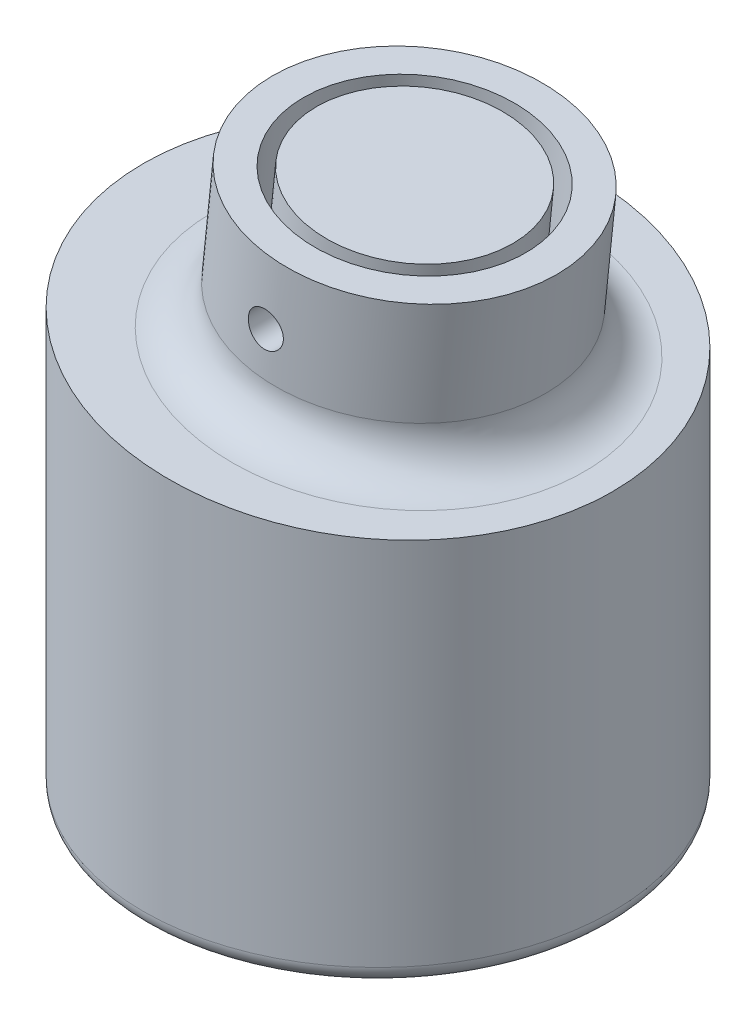
from build123d import *

# Parameters (mm, degrees)
SKETCH1_R                  = 26.8
MAIN_BODY_EXTRUDE_DEPTH    = 43.52
ANGLED_EXTRUDE_OUTLINE_R   = 26.8
ANGLED_EXTRUDE_DEPTH       = 5.63358701
ANGLED_START               = 46.082955702
ANGLED_EXTRUDE_2_OUTLINE_W = 57
ANGLED_EXTRUDE_2_OUTLINE_H = 56
ANGLED_EXTRUDE_2_DEPTH     = 6.917044298
SKETCH8_R                  = 16.325
ATTACHMENT_EXTRUDE_DEPTH   = 22.5
SKETCH11_R                 = 12.7625
SKETCH11_R_2               = 11.2625
TUBING_HOLE_DEPTH          = 45
SKETCH13_R                 = 2
BOLT_HOLE_DEPTH            = 25
SKETCH14_W                 = 34.35
SKETCH14_H                 = 34.35
CUT_EXTRUDE3_DEPTH         = 4
SKETCH16_W                 = 23.74
SKETCH16_H                 = 28.35
CUT_EXTRUDE5_DEPTH         = 1
FILLET3_R                  = 5
SKETCH18_R                 = 16.824719049
CUT_EXTRUDE6_DEPTH         = 5


with BuildPart() as part:
    # Sketch1 → Main Body Extrude (new body)
    with BuildSketch(Plane(origin=(0, 0, 0), x_dir=(1, 0, 0), z_dir=(0, 1, 0))):
        with Locations(Location((0, 0, 0), (0, 0, 270))):
            Circle(SKETCH1_R)
    extrude(amount=MAIN_BODY_EXTRUDE_DEPTH)

    # Angled Extrude: read off the stored shape, not the designer's step
    # Angled Extrude outline → Angled Extrude (add)
    with BuildSketch(Plane(origin=(0, 43.52, 0), x_dir=(1, 0, 0), z_dir=(0, 1, 0))):
        Circle(ANGLED_EXTRUDE_OUTLINE_R)
    extrude(amount=ANGLED_EXTRUDE_DEPTH)

    # Angled Extrude 2 outline → Angled Extrude 2 (cut)
    with BuildSketch(Plane(origin=(0, 0, 0), x_dir=(0.9945218953682733, -0.10452846326765303, 0), z_dir=(0.10452846326765304, 0.9945218953682734, 0)).offset(ANGLED_START)):
        with Locations((-4.5, 0)):
            Rectangle(ANGLED_EXTRUDE_2_OUTLINE_W, ANGLED_EXTRUDE_2_OUTLINE_H)
    extrude(amount=ANGLED_EXTRUDE_2_DEPTH, mode=Mode.SUBTRACT)

    # Sketch8 → Attachment Extrude (add)
    with BuildSketch(Plane(origin=(4.816980542, 45.830508449, 0), x_dir=(0.9945218953682734, -0.10452846326765328, 0), z_dir=(0.10452846326765328, 0.9945218953682734, 0))):
        with Locations((-2.478668524, 0)):
            Circle(SKETCH8_R)
    extrude(amount=ATTACHMENT_EXTRUDE_DEPTH)

    # Sketch11 → Tubing Hole (cut)
    with BuildSketch(Plane(origin=(7.168870966, 68.207251095, 0), x_dir=(0.9945218953682734, -0.10452846326765329, 0), z_dir=(0.10452846326765329, 0.9945218953682734, 0))):
        with Locations(Location((-2.478668524, 0, 0), (0, 0, 180))):
            Circle(SKETCH11_R)
        with Locations(Location((-2.478668524, 0, 0), (0, 0, 180))):
            Circle(SKETCH11_R_2, mode=Mode.SUBTRACT)
    extrude(amount=-TUBING_HOLE_DEPTH, mode=Mode.SUBTRACT)

    # Sketch13 → Bolt Hole (cut, symmetric)
    with BuildSketch(Plane.XY):
        with Locations((3.397175056, 56.034818814)):
            Circle(SKETCH13_R)
    extrude(amount=BOLT_HOLE_DEPTH, both=True, mode=Mode.SUBTRACT)

    # Sketch14 → Cut-Extrude3 (cut)
    with BuildSketch(Plane.XZ):
        Rectangle(SKETCH14_W, SKETCH14_H)
    extrude(amount=-CUT_EXTRUDE3_DEPTH, mode=Mode.SUBTRACT)

    # Sketch16 → Cut-Extrude5 (cut)
    with BuildSketch(Plane.XZ.offset(-4)):
        with Locations((-2.305, 0)):
            Rectangle(SKETCH16_W, SKETCH16_H)
    extrude(amount=-CUT_EXTRUDE5_DEPTH, mode=Mode.SUBTRACT)

    # Fillet1: read off the stored shape, not the designer's step
    # Fillet1 outline → Fillet1 (revolve, cut)
    with BuildSketch(Plane.XY):
        with BuildLine():
            ThreePointArc((26.8, 2), (26.214213562, 0.585786438), (24.8, 0))
            Line((24.8, 0), (26.8, 0))
            Line((26.8, 0), (26.8, 2))
        make_face()
    revolve(axis=Axis((0, 0, 0), (0, 1, 0)), mode=Mode.SUBTRACT)

    # Fillet3
    fillet3_edges = [part.edges().sort_by_distance(p)[0] for p in [
        (-13.883679518, 47.796027024, 0),
    ]]
    fillet(fillet3_edges, radius=FILLET3_R)

    # Sketch18 → Cut-Extrude6 (cut)
    with BuildSketch(Plane(origin=(7.168870966, 68.207251095, 0), x_dir=(0.9945218953682734, -0.10452846326765328, 0), z_dir=(0.10452846326765328, 0.9945218953682734, 0))):
        with Locations((-2.478668524, 0)):
            Circle(SKETCH18_R)
    extrude(amount=-CUT_EXTRUDE6_DEPTH, mode=Mode.SUBTRACT)


solid = part.part
